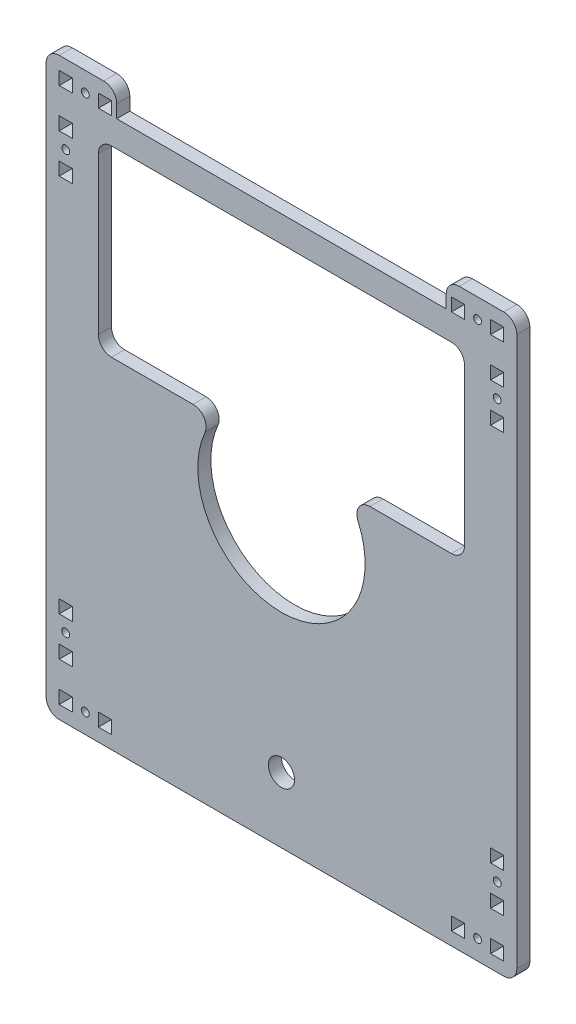
from build123d import *

# Parameters (mm, degrees)
BOSS_EXTRUDE1_OUTLINE_W   = 5
BOSS_EXTRUDE1_OUTLINE_H   = 5
BOSS_EXTRUDE1_OUTLINE_R   = 1.5
BOSS_EXTRUDE1_OUTLINE_R_2 = 5
BOSS_EXTRUDE1_DEPTH       = 5
FILLET1_R                 = 5


# Read off the part's stored shape, not the designer's step: Boss-Extrude1
with BuildPart() as part:
    # Boss-Extrude1 outline → Boss-Extrude1 (new body)
    with BuildSketch(Plane.XY):
        Polygon((-63, 110), (-90, 110), (-90, -110), (90, -110), (90, 110), (63, 110), (63, 100), (-63, 100), align=None)
        with Locations((-82.5, -102.5)):
            Rectangle(BOSS_EXTRUDE1_OUTLINE_W, BOSS_EXTRUDE1_OUTLINE_H, mode=Mode.SUBTRACT)
        with Locations((-75, -102.5)):
            Circle(BOSS_EXTRUDE1_OUTLINE_R, mode=Mode.SUBTRACT)
        with Locations((-82.5, -87.5)):
            Rectangle(BOSS_EXTRUDE1_OUTLINE_W, BOSS_EXTRUDE1_OUTLINE_H, mode=Mode.SUBTRACT)
        with Locations((-67.5, -102.5)):
            Rectangle(BOSS_EXTRUDE1_OUTLINE_W, BOSS_EXTRUDE1_OUTLINE_H, mode=Mode.SUBTRACT)
        with Locations((-82.5, -80)):
            Circle(BOSS_EXTRUDE1_OUTLINE_R, mode=Mode.SUBTRACT)
        with Locations((-82.5, -72.5)):
            Rectangle(BOSS_EXTRUDE1_OUTLINE_W, BOSS_EXTRUDE1_OUTLINE_H, mode=Mode.SUBTRACT)
        with Locations((0, -85)):
            Circle(BOSS_EXTRUDE1_OUTLINE_R_2, mode=Mode.SUBTRACT)
        with Locations((67.5, -102.5)):
            Rectangle(BOSS_EXTRUDE1_OUTLINE_W, BOSS_EXTRUDE1_OUTLINE_H, mode=Mode.SUBTRACT)
        with Locations((75, -102.5)):
            Circle(BOSS_EXTRUDE1_OUTLINE_R, mode=Mode.SUBTRACT)
        with Locations((82.5, -102.5)):
            Rectangle(BOSS_EXTRUDE1_OUTLINE_W, BOSS_EXTRUDE1_OUTLINE_H, mode=Mode.SUBTRACT)
        with Locations((82.5, -87.5)):
            Rectangle(BOSS_EXTRUDE1_OUTLINE_W, BOSS_EXTRUDE1_OUTLINE_H, mode=Mode.SUBTRACT)
        with Locations((82.5, -80)):
            Circle(BOSS_EXTRUDE1_OUTLINE_R, mode=Mode.SUBTRACT)
        with Locations((82.5, -72.5)):
            Rectangle(BOSS_EXTRUDE1_OUTLINE_W, BOSS_EXTRUDE1_OUTLINE_H, mode=Mode.SUBTRACT)
        with Locations((-82.5, 72.5)):
            Rectangle(BOSS_EXTRUDE1_OUTLINE_W, BOSS_EXTRUDE1_OUTLINE_H, mode=Mode.SUBTRACT)
        with Locations((-82.5, 80)):
            Circle(BOSS_EXTRUDE1_OUTLINE_R, mode=Mode.SUBTRACT)
        with Locations((-82.5, 87.5)):
            Rectangle(BOSS_EXTRUDE1_OUTLINE_W, BOSS_EXTRUDE1_OUTLINE_H, mode=Mode.SUBTRACT)
        with Locations((-82.5, 102.5)):
            Rectangle(BOSS_EXTRUDE1_OUTLINE_W, BOSS_EXTRUDE1_OUTLINE_H, mode=Mode.SUBTRACT)
        with Locations((-75, 102.5)):
            Circle(BOSS_EXTRUDE1_OUTLINE_R, mode=Mode.SUBTRACT)
        with Locations((-67.5, 102.5)):
            Rectangle(BOSS_EXTRUDE1_OUTLINE_W, BOSS_EXTRUDE1_OUTLINE_H, mode=Mode.SUBTRACT)
        with BuildLine():
            Line((70, 20), (24.979991994, 20))
            ThreePointArc((24.979991994, 20), (0, -32), (-24.979991994, 20))
            Line((-24.979991994, 20), (-70, 20))
            Line((-70, 20), (-70, 90))
            Line((-70, 90), (70, 90))
            Line((70, 90), (70, 20))
        make_face(mode=Mode.SUBTRACT)
        with Locations((82.5, 72.5)):
            Rectangle(BOSS_EXTRUDE1_OUTLINE_W, BOSS_EXTRUDE1_OUTLINE_H, mode=Mode.SUBTRACT)
        with Locations((82.5, 80)):
            Circle(BOSS_EXTRUDE1_OUTLINE_R, mode=Mode.SUBTRACT)
        with Locations((82.5, 87.5)):
            Rectangle(BOSS_EXTRUDE1_OUTLINE_W, BOSS_EXTRUDE1_OUTLINE_H, mode=Mode.SUBTRACT)
        with Locations((67.5, 102.5)):
            Rectangle(BOSS_EXTRUDE1_OUTLINE_W, BOSS_EXTRUDE1_OUTLINE_H, mode=Mode.SUBTRACT)
        with Locations((75, 102.5)):
            Circle(BOSS_EXTRUDE1_OUTLINE_R, mode=Mode.SUBTRACT)
        with Locations((82.5, 102.5)):
            Rectangle(BOSS_EXTRUDE1_OUTLINE_W, BOSS_EXTRUDE1_OUTLINE_H, mode=Mode.SUBTRACT)
    extrude(amount=BOSS_EXTRUDE1_DEPTH)

    # Fillet1
    fillet1_edges = [part.edges().sort_by_distance(p)[0] for p in [
        (-63, 110, 2.5),
        (63, 110, 2.5),
        (90, 110, 2.5),
        (90, -110, 2.5),
        (-90, -110, 2.5),
        (-90, 110, 2.5),
        (-24.979991994, 20, 2.5),
        (24.979991994, 20, 2.5),
        (70, 20, 2.5),
        (70, 90, 2.5),
        (-70, 90, 2.5),
        (-70, 20, 2.5),
    ]]
    fillet(fillet1_edges, radius=FILLET1_R)


solid = part.part
